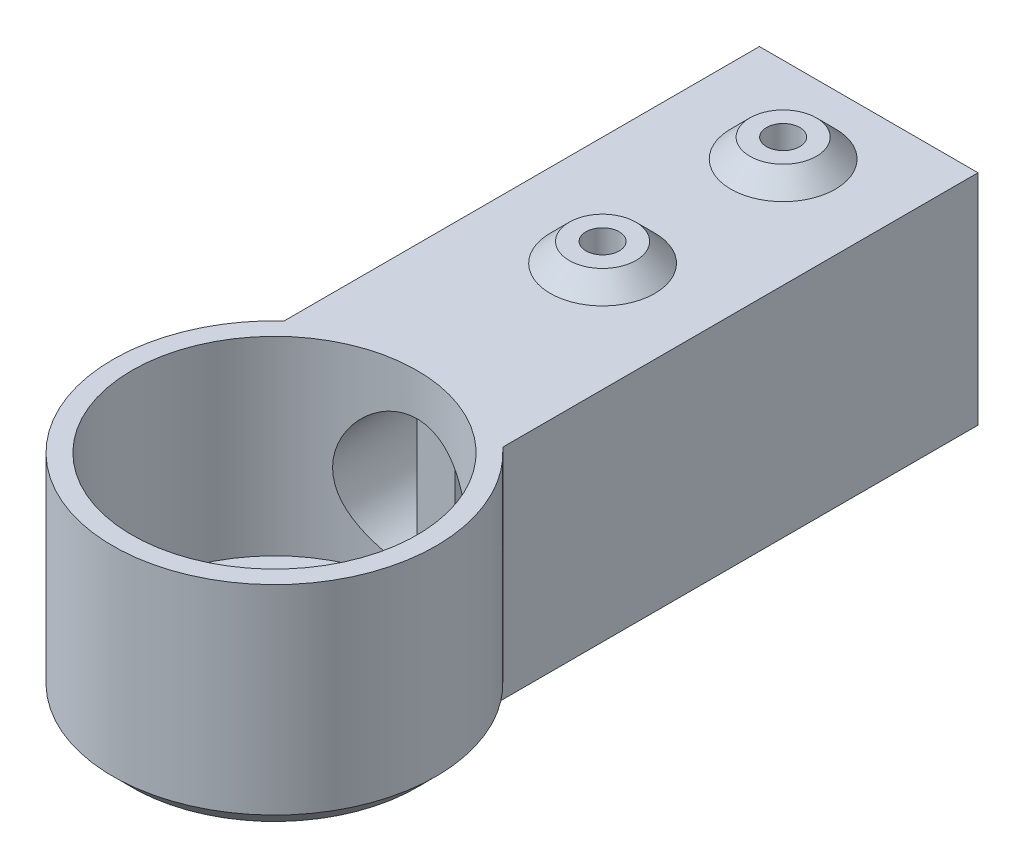
from build123d import *

# Parameters (mm, degrees)
SCHIZZO1_W                     = 23
SCHIZZO1_H                     = 23
ESTRUSIONE_ESTRUSIONE1_DEPTH   = 50
SCHIZZO3_R                     = 17
TAGLIO_ESTRUSIONE2_DEPTH       = 58.057295879
SCHIZZO4_R                     = 17
SCHIZZO4_R_2                   = 15
ESTRUSIONE_ESTRUSIONE2_DEPTH   = 23
ESTRUSIONE_ESTRUSIONE3_START   = -2
SCHIZZO6_R                     = 15
ESTRUSIONE_ESTRUSIONE3_DEPTH   = 2
ESTRUSIONE_ESTRUSIONE4_START   = 1
SCHIZZO11_R                    = 15
ESTRUSIONE_ESTRUSIONE4_DEPTH   = 1
SMUSSO2_SIZE                   = 2
SCHIZZO12_R                    = 2.5
TAGLIO_ESTRUSIONE6_DEPTH       = 85.53268453
SCHIZZO13_R                    = 4.75
TAGLIO_ESTRUSIONE7_DEPTH       = 2
SCHIZZO14_R                    = 1.5
TAGLIO_ESTRUSIONE9_DEPTH       = 85.53268453
TAGLIO_ESTRUSIONE11_DEPTH      = 85.53268453
TAGLIO_ESTRUSIONE12_REACH      = 85.286
TAGLIO_ESTRUSIONE12_END_RADIUS = 15
SCHIZZO18_R                    = 7.1
ESTRUSIONE_ESTRUSIONE5_REACH   = 87.292
SCHIZZO19_W                    = 4
SCHIZZO19_H                    = 3
SCHIZZO21_R                    = 5.5
ESTRUSIONE_ESTRUSIONE6_DEPTH   = 2
SCHIZZO20_R                    = 1.75
TAGLIO_ESTRUSIONE13_DEPTH      = 86.853216328
SMUSSO3_SIZE                   = 2
SMUSSO4_SIZE                   = 1
SMUSSO4_SIZE2                  = 3


with BuildPart() as part:
    # Schizzo1 → Estrusione-Estrusione1 (new body)
    with BuildSketch(Plane.XY):
        with Locations((-3.551080126, 2.313028552)):
            Rectangle(SCHIZZO1_W, SCHIZZO1_H)
    extrude(amount=ESTRUSIONE_ESTRUSIONE1_DEPTH)

    # Schizzo3 → Taglio-Estrusione2 (cut, through all)
    with BuildSketch(Plane(origin=(0, 13.813028552, 0), x_dir=(1, 0, 0), z_dir=(0, 1, 0))):
        with Locations((-3.551080126, -62.519984026)):
            Circle(SCHIZZO3_R)
    extrude(amount=-TAGLIO_ESTRUSIONE2_DEPTH, mode=Mode.SUBTRACT)

    # Schizzo4 → Estrusione-Estrusione2 (add, through all)
    with BuildSketch(Plane(origin=(0, 13.813028552, 0), x_dir=(1, 0, 0), z_dir=(0, 1, 0))):
        with Locations((-3.551080126, -62.519984026)):
            Circle(SCHIZZO4_R)
        with Locations(Location((-3.551080126, -62.519984026, 0), (0, 0, 180))):
            Circle(SCHIZZO4_R_2, mode=Mode.SUBTRACT)
    extrude(amount=-ESTRUSIONE_ESTRUSIONE2_DEPTH)

    # Schizzo6 → Estrusione-Estrusione3 (add)
    with BuildSketch(Plane.XZ.offset(9.186971448).offset(ESTRUSIONE_ESTRUSIONE3_START)):
        with Locations(Location((-3.551080126, 62.519984026, 0), (0, 0, 180))):
            Circle(SCHIZZO6_R)
    extrude(amount=ESTRUSIONE_ESTRUSIONE3_DEPTH)

    # Schizzo11 → Estrusione-Estrusione4 (add)
    with BuildSketch(Plane(origin=(0, -7.186971448, 0), x_dir=(1, 0, 0), z_dir=(0, 1, 0)).offset(ESTRUSIONE_ESTRUSIONE4_START)):
        with Locations(Location((-3.551080126, -62.519984026, 0), (0, 0, 180))):
            Circle(SCHIZZO11_R)
    extrude(amount=-ESTRUSIONE_ESTRUSIONE4_DEPTH)

    # Smusso2
    smusso2_edges = [part.edges().sort_by_distance(p)[0] for p in [
        (-3.551080126, -9.186971448, 79.519984026),
    ]]
    chamfer(smusso2_edges, length=SMUSSO2_SIZE)

    # Schizzo12 → Taglio-Estrusione6 (cut, through all)
    with BuildSketch(Plane(origin=(0, -6.186971448, 0), x_dir=(1, 0, 0), z_dir=(0, 1, 0))):
        with Locations(Location((-3.551080126, -62.519984026, 0), (0, 0, 270))):
            Circle(SCHIZZO12_R)
    extrude(amount=-TAGLIO_ESTRUSIONE6_DEPTH, mode=Mode.SUBTRACT)

    # Schizzo13 → Taglio-Estrusione7 (cut)
    with BuildSketch(Plane(origin=(0, -6.186971448, 0), x_dir=(1, 0, 0), z_dir=(0, 1, 0))):
        with Locations(Location((-3.551080126, -62.519984026, 0), (0, 0, 270))):
            Circle(SCHIZZO13_R)
    extrude(amount=-TAGLIO_ESTRUSIONE7_DEPTH, mode=Mode.SUBTRACT)

    # Schizzo14 → Taglio-Estrusione9 (cut, through all)
    with BuildSketch(Plane(origin=(0, -6.186971448, 0), x_dir=(1, 0, 0), z_dir=(0, 1, 0))):
        with Locations(Location((-9.808086042, -55.37156623, 0), (0, 0, 180))):
            Circle(SCHIZZO14_R)
        with Locations(Location((2.705925789, -69.668401821, 0), (0, 0, 180))):
            Circle(SCHIZZO14_R)
        with Locations(Location((-9.570800375, -67.789041638, 0), (0, 0, 180))):
            Circle(SCHIZZO14_R)
        with Locations(Location((2.468640122, -57.250926413, 0), (0, 0, 180))):
            Circle(SCHIZZO14_R)
    extrude(amount=-TAGLIO_ESTRUSIONE9_DEPTH, mode=Mode.SUBTRACT)

    # Schizzo17 → Taglio-Estrusione11 (cut, through all)
    with BuildSketch(Plane(origin=(0, -6.186971448, 0), x_dir=(1, 0, 0), z_dir=(0, 1, 0))):
        with BuildLine():
            Line((-5.034715393, -69.299017071), (-5.727078518, -73.947740907))
            ThreePointArc((-5.727078518, -73.947740907), (-3.551080126, -76.471825774), (-1.375081735, -73.947740907))
            Line((-1.375081735, -73.947740907), (-2.06744486, -69.299017071))
            ThreePointArc((-2.06744486, -69.299017071), (-3.551080126, -68.019984026), (-5.034715393, -69.299017071))
        make_face()
        with BuildLine():
            Line((3.227952919, -64.003619292), (7.876676755, -64.695982417))
            ThreePointArc((7.876676755, -64.695982417), (10.400761622, -62.519984026), (7.876676755, -60.343985634))
            Line((7.876676755, -60.343985634), (3.227952919, -61.036348759))
            ThreePointArc((3.227952919, -61.036348759), (1.948919874, -62.519984026), (3.227952919, -64.003619292))
        make_face()
        with BuildLine():
            Line((-10.330113172, -61.036348759), (-14.978837008, -60.343985634))
            ThreePointArc((-14.978837008, -60.343985634), (-17.502921875, -62.519984026), (-14.978837008, -64.695982417))
            Line((-14.978837008, -64.695982417), (-10.330113172, -64.003619292))
            ThreePointArc((-10.330113172, -64.003619292), (-9.051080126, -62.519984026), (-10.330113172, -61.036348759))
        make_face()
        with BuildLine():
            Line((-2.06744486, -55.74095098), (-1.375081735, -51.092227144))
            ThreePointArc((-1.375081735, -51.092227144), (-3.551080126, -48.568142277), (-5.727078518, -51.092227144))
            Line((-5.727078518, -51.092227144), (-5.034715393, -55.74095098))
            ThreePointArc((-5.034715393, -55.74095098), (-3.551080126, -57.019984026), (-2.06744486, -55.74095098))
        make_face()
    extrude(amount=-TAGLIO_ESTRUSIONE11_DEPTH, mode=Mode.SUBTRACT)

    # Taglio-Estrusione12: up to this cylinder (the profile starts outside it)
    taglio_estrusione12_end = Plane(origin=(-3.551080126, 2.313029, 62.519984026), z_dir=(0, 1, 0)) * Cylinder(TAGLIO_ESTRUSIONE12_END_RADIUS, 201.572, mode=Mode.PRIVATE)
    # Schizzo18 → Taglio-Estrusione12 (cut, up to the surface)
    with BuildSketch(Plane(origin=(0, 0, 0), x_dir=(-1, 0, 0), z_dir=(0, 0, -1)), mode=Mode.PRIVATE) as taglio_estrusione12_sk1:
        with Locations((3.551080126, 2.313028552)):
            Circle(SCHIZZO18_R)
    taglio_estrusione12_tool1 = extrude(taglio_estrusione12_sk1.sketch, amount=-TAGLIO_ESTRUSIONE12_REACH, mode=Mode.PRIVATE) - taglio_estrusione12_end
    add(taglio_estrusione12_tool1.solids().sort_by_distance((-3.55108, 2.313029, 0))[0], mode=Mode.SUBTRACT)

    # Schizzo19 → Estrusione-Estrusione5 (add, up to next)
    with BuildSketch(Plane(origin=(0, 13.813028552, 0), x_dir=(1, 0, 0), z_dir=(0, 1, 0)), mode=Mode.PRIVATE) as estrusione_estrusione5_sk1:
        with Locations((-3.551080126, -44.019984026)):
            Rectangle(SCHIZZO19_W, SCHIZZO19_H)
    estrusione_estrusione5_tool1 = extrude(estrusione_estrusione5_sk1.sketch, amount=-ESTRUSIONE_ESTRUSIONE5_REACH, mode=Mode.PRIVATE) - part.part
    add(estrusione_estrusione5_tool1.solids().sort_by_distance((-3.55108, 13.813029, 44.019984))[0])

    # Schizzo21 → Estrusione-Estrusione6 (add)
    with BuildSketch(Plane(origin=(0, 13.813028552, 0), x_dir=(1, 0, 0), z_dir=(0, 1, 0))):
        with Locations((-3.551080126, -9)):
            Circle(SCHIZZO21_R)
        with Locations((-3.551080126, -28)):
            Circle(SCHIZZO21_R)
    extrude(amount=ESTRUSIONE_ESTRUSIONE6_DEPTH)

    # Schizzo20 → Taglio-Estrusione13 (cut, through all)
    with BuildSketch(Plane(origin=(0, 15.813028552, 0), x_dir=(1, 0, 0), z_dir=(0, 1, 0))):
        with Locations(Location((-3.551080126, -9, 0), (0, 0, 180))):
            Circle(SCHIZZO20_R)
        with Locations(Location((-3.551080126, -28, 0), (0, 0, 180))):
            Circle(SCHIZZO20_R)
    extrude(amount=-TAGLIO_ESTRUSIONE13_DEPTH, mode=Mode.SUBTRACT)

    # Smusso3
    smusso3_edges = [part.edges().sort_by_distance(p)[0] for p in [
        (-9.051080126, 15.813028552, 9),
        (-9.051080126, 15.813028552, 28),
    ]]
    chamfer(smusso3_edges, length=SMUSSO3_SIZE - 0.0001)  # a hair under: the kernel refuses the full size

    # Smusso4
    smusso4_edges = [part.edges().sort_by_distance(p)[0] for p in [
        (3.548919874, 2.313028552, 0),
    ]]
    smusso4_side = [part.faces().sort_by_distance(p)[0] for p in [
        (-3.551080126, 13.487759433, 0),
    ]]
    chamfer(smusso4_edges, length=SMUSSO4_SIZE, length2=SMUSSO4_SIZE2, reference=smusso4_side[0])


solid = part.part
